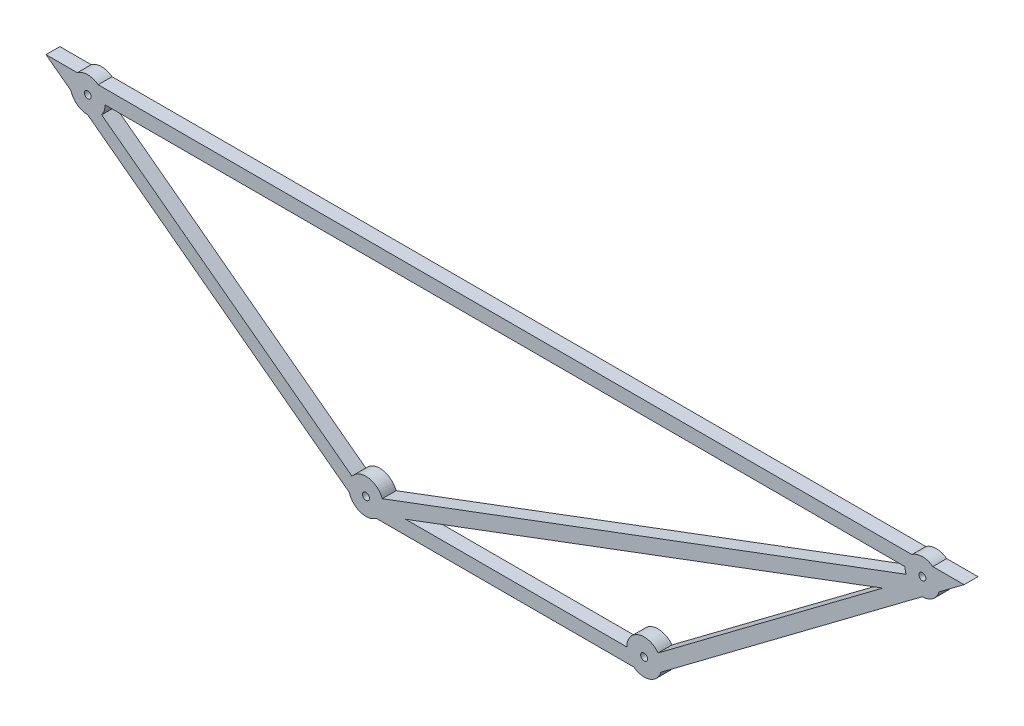
from build123d import *

# Parameters (mm, degrees)
EXTRUDE_THIN2_DEPTH = 20
SKETCH4_R           = 5
CUT_EXTRUDE1_DEPTH  = 1302.393483924


# Read off the part's stored shape, not the designer's step: Extrude-Thin2
with BuildPart() as part:
    # Extrude-Thin2 outline → Extrude-Thin2 (new body)
    with BuildSketch(Plane.XY):
        with BuildLine():
            Line((-15, 20), (-60, 20))
            Line((-60, 20), (-24, -7))
            ThreePointArc((-24, -7), (-15, -20), (0, -25))
            Line((0, -25), (376, -307))
            ThreePointArc((376, -307), (392.09430585, -323.717082451), (415, -320))
            Line((415, -320), (785, -320))
            ThreePointArc((785, -320), (807.90569415, -323.717082451), (824, -307))
            Line((824, -307), (1200, -25))
            ThreePointArc((1200, -25), (1215, -20), (1224, -7))
            Line((1224, -7), (1260, 20))
            Line((1260, 20), (1215, 20))
            ThreePointArc((1215, 20), (1200, 25), (1185, 20))
            Line((1185, 20), (15, 20))
            ThreePointArc((15, 20), (0, 25), (-15, 20))
        make_face()
        with BuildLine():
            Line((456.960024969, -300), (1143.039975031, -42.720018727))
            Line((1143.039975031, -42.720018727), (820, -285))
            ThreePointArc((820, -285), (792.09430585, -276.282917549), (775, -300))
            Line((775, -300), (456.960024969, -300))
        make_face(mode=Mode.SUBTRACT)
        with BuildLine():
            ThreePointArc((1175, 0), (1175.401161247, -4.460620138), (1176.591770561, -8.77808604))
            Line((1176.591770561, -8.77808604), (423.408229439, -291.22191396))
            ThreePointArc((423.408229439, -291.22191396), (403.547120002, -275.252920583), (380, -285))
            Line((380, -285), (20, -15))
            ThreePointArc((20, -15), (23.717082451, -7.90569415), (25, 0))
            Line((25, 0), (1175, 0))
        make_face(mode=Mode.SUBTRACT)
    extrude(amount=EXTRUDE_THIN2_DEPTH)

    # Sketch4 → Cut-Extrude1 (cut, through all)
    with BuildSketch(Plane.XY.offset(20)):
        Circle(SKETCH4_R)
        with Locations((400, -300)):
            Circle(SKETCH4_R)
        with Locations((800, -300)):
            Circle(SKETCH4_R)
        with Locations((1200, 0)):
            Circle(SKETCH4_R)
    extrude(amount=-CUT_EXTRUDE1_DEPTH, mode=Mode.SUBTRACT)


solid = part.part
